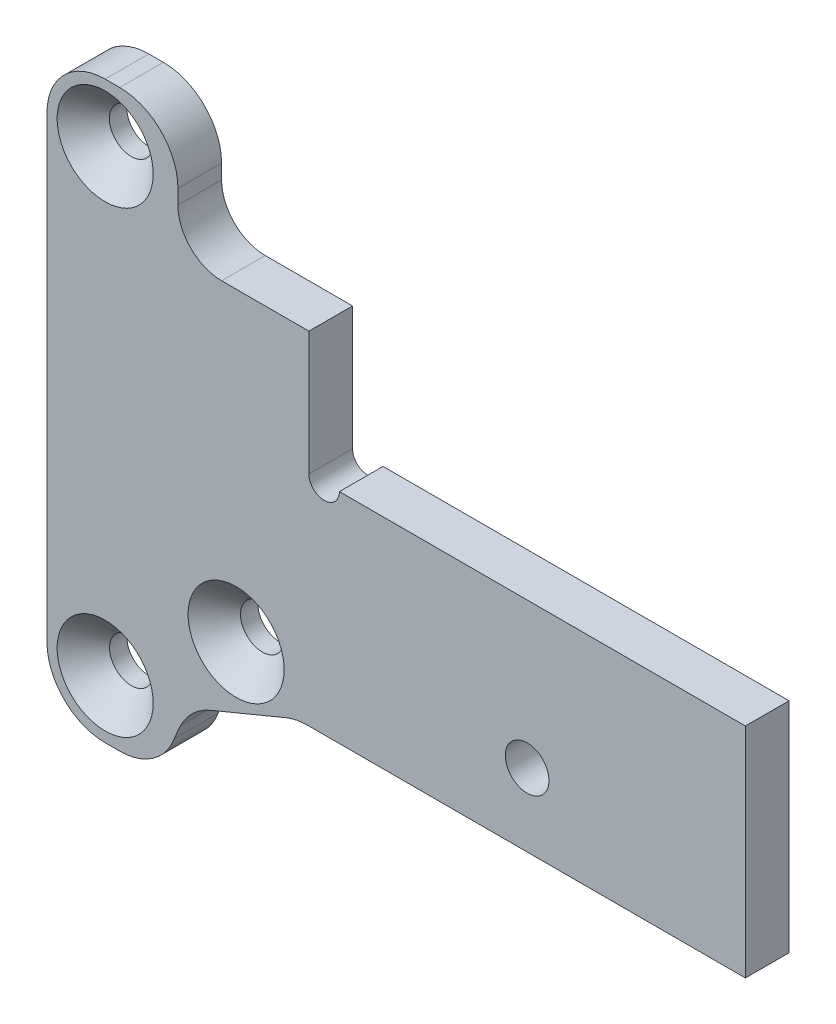
from build123d import *

# Parameters (mm, degrees)
SKETCH_1_W                  = 30
SKETCH_1_H                  = 15
EXTRUDE_1_DEPTH             = 3
EXTRUDE_2_DEPTH             = 3
FILLET_1_R                  = 4
FILLET_2_R                  = 3
FILLET_5_R                  = 4
FILLET_6_R                  = 4
SKETCH_3_R                  = 1.05
CUT_EXTRUDE_1_DEPTH         = 3
SKETCH_4_R                  = 1.505
CUT_EXTRUDE_2_DEPTH         = 40
EXTRUDE_START               = -11
EXTRUDE_3_OUTLINE_W         = 5.656854249
EXTRUDE_3_OUTLINE_H         = 3
EXTRUDE_3_DEPTH             = 2.161165235
SKETCH_7_R                  = 1.5
CUT_EXTRUDE_3_DEPTH         = 40
FILLET_7_R                  = 10
FILLET_8_R                  = 10
SKETCH_8_R                  = 1.5
CUT_EXTRUDE_4_DEPTH         = 40
EXTRUDE_4_DEPTH             = 3
HOLE_WIZARD_M3_1_AT_2_COUNT = 2
HOLE_WIZARD_M3_1_AT_2_PITCH = 26.570660511
HOLE_WIZARD_M3_1_AT_3_COUNT = 2
HOLE_WIZARD_M3_1_AT_3_PITCH = 31.5
FILLET_9_R                  = 4
SKETCH_12_R                 = 1.5
CUT_EXTRUDE_5_DEPTH         = 20.5


with BuildPart() as part:
    # 草图1 → 凸台-拉伸1 (new body)
    with BuildSketch(Plane.XY):
        Rectangle(SKETCH_1_W, SKETCH_1_H)
    extrude(amount=EXTRUDE_1_DEPTH)

    # 草图2 → 凸台-拉伸2 (add)
    with BuildSketch(Plane.XY.offset(3)):
        Polygon((-15, 7.5), (-15, 16), (-24, 16), (-24, 24), (-33, 24), (-33, -15.5), (-24, -15.5), (-24, -7.5), (-15, -7.5), align=None)
    extrude(amount=-EXTRUDE_2_DEPTH)

    # 圆角1
    fillet_1_edges = [part.edges().sort_by_distance(p)[0] for p in [
        (-24, 24, 1.5),
        (-33, 24, 1.5),
    ]]
    fillet(fillet_1_edges, radius=FILLET_1_R)

    # 圆角2
    fillet_2_edges = [part.edges().sort_by_distance(p)[0] for p in [
        (-24, 16, 1.5),
    ]]
    fillet(fillet_2_edges, radius=FILLET_2_R)

    # 圆角5
    fillet_5_edges = [part.edges().sort_by_distance(p)[0] for p in [
        (-33, -15.5, 1.5),
        (-24, -15.5, 1.5),
    ]]
    fillet(fillet_5_edges, radius=FILLET_5_R)

    # 圆角6
    fillet_6_edges = [part.edges().sort_by_distance(p)[0] for p in [
        (-24, -7.5, 1.5),
    ]]
    fillet(fillet_6_edges, radius=FILLET_6_R - 0.0001)  # a hair under: the kernel refuses the full size

    # 草图3 → 切除-拉伸1 (cut)
    with BuildSketch(Plane.XY.offset(3)):
        with Locations((-13.95, 7.5)):
            Circle(SKETCH_3_R)
    extrude(amount=-CUT_EXTRUDE_1_DEPTH, mode=Mode.SUBTRACT)

    # 草图4 → 切除-拉伸2 (cut)
    with BuildSketch(Plane.XY.offset(3)):
        with Locations((-29, 20)):
            Circle(SKETCH_4_R)
    extrude(amount=-CUT_EXTRUDE_2_DEPTH, mode=Mode.SUBTRACT)

    # 凸台-拉伸3: read off the stored shape, not the designer's step
    # 凸台-拉伸3 outline → 凸台-拉伸3 (add)
    with BuildSketch(Plane(origin=(0, 0, 0), x_dir=(0.7071067811865471, 0.707106781186548, 0), z_dir=(0.707106781186548, -0.707106781186547, 0)).offset(EXTRUDE_START)):
        with Locations((-22.273863608, 1.5)):
            Rectangle(EXTRUDE_3_OUTLINE_W, EXTRUDE_3_OUTLINE_H)
    extrude(amount=EXTRUDE_3_DEPTH)

    # 草图7 → 切除-拉伸3 (cut)
    with BuildSketch(Plane.XY.offset(3)):
        with Locations((-20, -5)):
            Circle(SKETCH_7_R)
    extrude(amount=-CUT_EXTRUDE_3_DEPTH, mode=Mode.SUBTRACT)

    # 圆角7
    fillet_7_edges = [part.edges().sort_by_distance(p)[0] for p in [
        (-20, -7.5, 1.5),
    ]]
    fillet(fillet_7_edges, radius=FILLET_7_R)

    # 圆角8
    # the kernel refuses this fillet: 10 mm, written as the material it adds along each edge
    with BuildSketch(Plane(origin=(-24, -11.5, 3), x_dir=(0.7071067811080579, 0.7071067812650372, 0), z_dir=(0, 0, -1))) as fillet_8_piece_1:
        with BuildLine():
            CenterArc((3.037620293, 9.883358261), FILLET_8_R, 245.228316877, 16.01201465)
            Line((-1.152413577, 0.803511557), (-1.236214254, 0.621914623))
            ThreePointArc((-1.236214254, 0.621914623), (-0.655043014, 0.288687166), (-0.141421356, -0.141421356))
            Line((-0.141421356, -0.141421356), (0, -0.2))
            ThreePointArc((0, -0.2), (0.757359313, -0.2), (1.484260592, -0.197667165))
            Line((1.484260592, -0.197667165), (1.514718626, 0))
        make_face()
    extrude(amount=3)

    # 草图8 → 切除-拉伸4 (cut)
    with BuildSketch(Plane.XY.offset(3)):
        with Locations((-29, -11.5)):
            Circle(SKETCH_8_R)
    extrude(amount=-CUT_EXTRUDE_4_DEPTH, mode=Mode.SUBTRACT)

    # 草图11 → 凸台-拉伸4 (add)
    with BuildSketch(Plane.XY.offset(3)):
        with BuildLine():
            Line((-15.857864376, -7.5), (-22.928932188, -10.428932188))
            ThreePointArc((-22.928932188, -10.428932188), (-19.6846987, -8.261204675), (-15.857864376, -7.5))
        make_face()
    extrude(amount=-EXTRUDE_4_DEPTH)

    # 草图10 → M3 十字槽半沉头木螺钉的锥形沉头孔1 (revolve, cut)
    with BuildSketch(Plane(origin=(-29, 20, 3), x_dir=(0, -1, 0), z_dir=(1, 0, 0))):
        Polygon((0, 0), (0, 3), (1.5, 3), (1.5, 1.8), (3.3, 0), align=None)
    hole_wizard_m3_1 = revolve(axis=Axis((-29, 20, 9.35), (0, 0, -1)), mode=Mode.SUBTRACT)

    # M3 十字槽半沉头木螺钉的锥形沉头孔1 at 2: M3 十字槽半沉头木螺钉的锥形沉头孔1 ×2
    with Locations(*[Vector(0.33871946827274174, -0.9408874118687268, 0) * (i * HOLE_WIZARD_M3_1_AT_2_PITCH) for i in range(1, HOLE_WIZARD_M3_1_AT_2_COUNT)]):
        add(hole_wizard_m3_1, mode=Mode.SUBTRACT)

    # M3 十字槽半沉头木螺钉的锥形沉头孔1 at 3: M3 十字槽半沉头木螺钉的锥形沉头孔1 ×2
    with Locations(*[(0, -i * HOLE_WIZARD_M3_1_AT_3_PITCH, 0) for i in range(1, HOLE_WIZARD_M3_1_AT_3_COUNT)]):
        add(hole_wizard_m3_1, mode=Mode.SUBTRACT)

    # 圆角9
    fillet_9_edges = [part.edges().sort_by_distance(p)[0] for p in [
        (-15.857864377, -7.5, 1.5),
        (-22.928932188, -10.428932188, 1.5),
    ]]
    fillet(fillet_9_edges, radius=FILLET_9_R)

    # 草图12 → 切除-拉伸5 (cut, symmetric)
    with BuildSketch(Plane.XY.offset(3)):
        with Locations(Location((0, -2.5, 0), (0, 0, 180))):
            Circle(SKETCH_12_R)
    extrude(amount=CUT_EXTRUDE_5_DEPTH, both=True, mode=Mode.SUBTRACT)


solid = part.part
